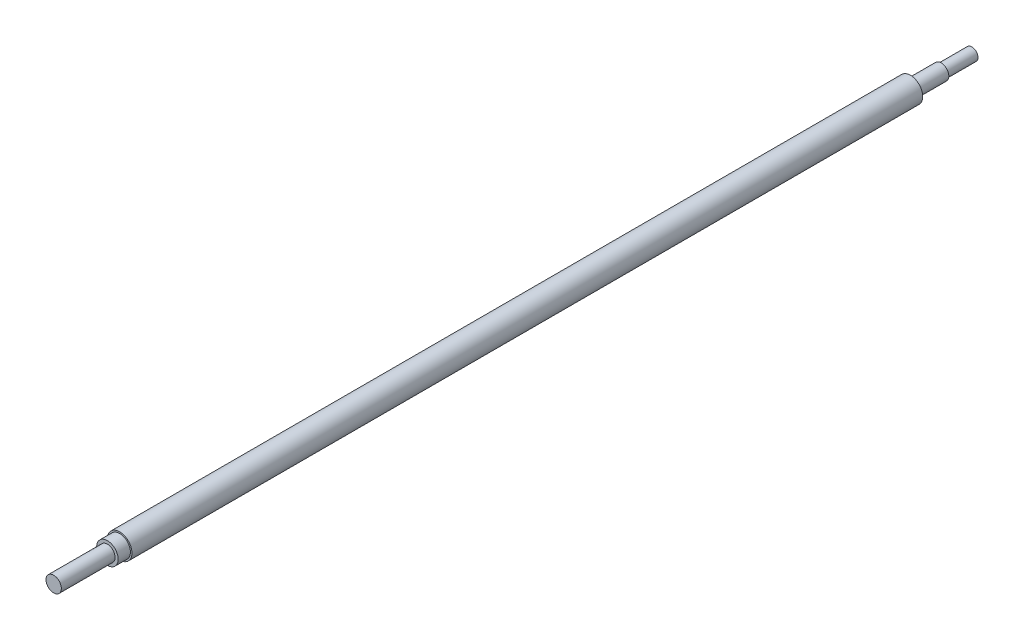
from build123d import *


with BuildPart() as part:
    # Schizzo2 → Rivoluzione2 (revolve)
    with BuildSketch(Plane(origin=(0, 0, 0), x_dir=(0, 0, -1), z_dir=(1, 0, 0))):
        Polygon((-2, 0), (-2, 5), (33, 5), (33, 7), (41, 7), (41, 8), (556, 8), (556, 5), (576, 5), (576, 4), (596, 4), (596, 0), align=None)
    revolve(axis=Axis((0, 0, 0), (0, 0, -1)))


solid = part.part
